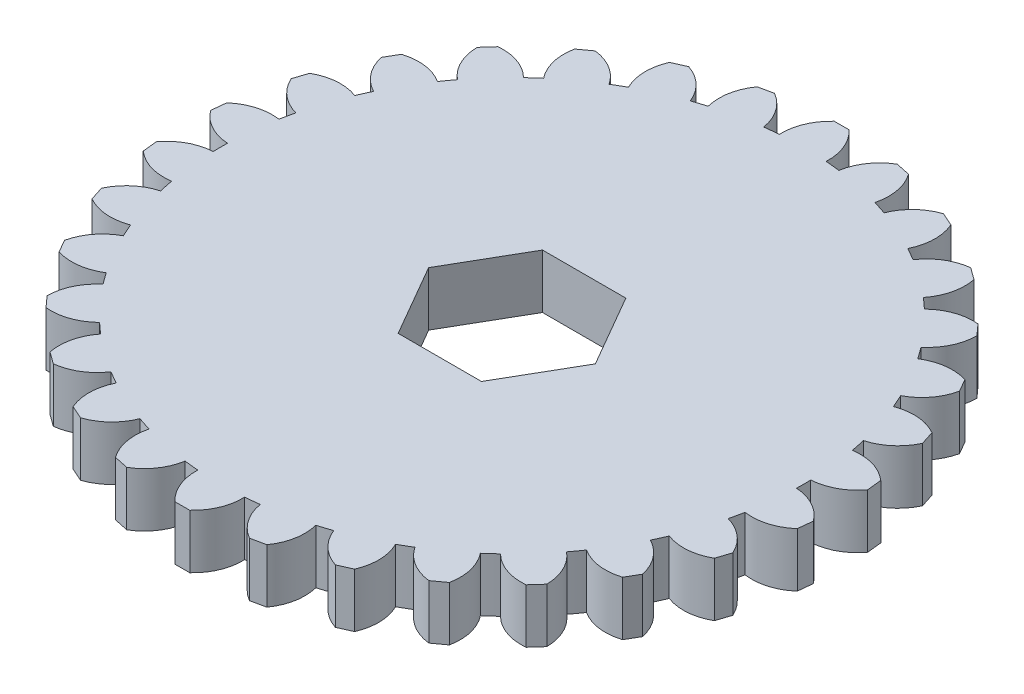
from build123d import *

# Parameters (mm, degrees)
SKETCH2_R           = 25.664173075
BOSS_EXTRUDE2_DEPTH = 4.7625
BOSS_EXTRUDE3_DEPTH = 4.7625
CIRPATTERN1_COUNT   = 30


with BuildPart() as part:
    # Sketch2 → Boss-Extrude2 (new body)
    with BuildSketch(Plane(origin=(0, 0, 0), x_dir=(1, 0, 0), z_dir=(0, 1, 0))):
        Circle(SKETCH2_R)
        Polygon((7.332348419, 0), (3.666174209, 6.35), (-3.666174209, 6.35), (-7.332348419, 0), (-3.666174209, -6.35), (3.666174209, -6.35), align=None, mode=Mode.SUBTRACT)
    extrude(amount=BOSS_EXTRUDE2_DEPTH)

    # Sketch1 → Boss-Extrude3 (add)
    with BuildSketch(Plane(origin=(0, 0, 0), x_dir=(1, 0, 0), z_dir=(0, 1, 0))):
        with BuildLine():
            Line((0.645352642, 28.995983589), (-0.645352642, 28.995983589))
            ThreePointArc((-0.645352642, 28.995983589), (-1.731037977, 27.445464243), (-2.059725259, 25.581386037))
            ThreePointArc((-2.059725259, 25.581386037), (0, 25.664173077), (2.059725259, 25.581386037))
            ThreePointArc((2.059725259, 25.581386037), (1.731037977, 27.445464243), (0.645352642, 28.995983589))
        make_face()
    boss_extrude3 = extrude(amount=BOSS_EXTRUDE3_DEPTH)

    # CirPattern1: Boss-Extrude3 ×30 about axis
    cirpattern1_axis = Axis((0, 4.7625, 0), (0, -1, 0))
    for i in range(1, CIRPATTERN1_COUNT):
        add(boss_extrude3.rotate(cirpattern1_axis, i * 360 / CIRPATTERN1_COUNT))


solid = part.part
